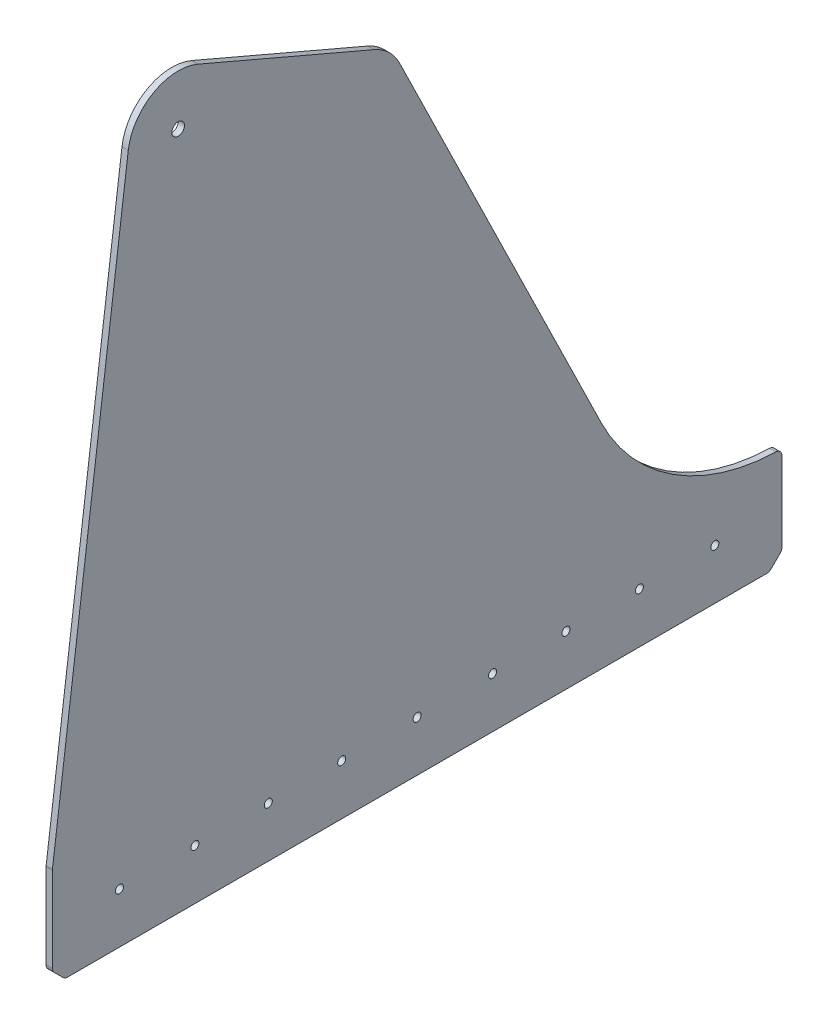
from build123d import *

# Parameters (mm, degrees)
PLATE_DEPTH                = 3.175
DRIVE_HOLES_D              = 4.064
SKETCH3_R                  = 3.175
TUBE_PIVOT_HOLES_DEPTH     = 521.864531932
BOTTOM_CORNER_CHAMFER_SIZE = 6.35
BOTTOM_CORNER_FILLET_R     = 3.175


with BuildPart() as part:
    # Sketch2 → Plate (new body)
    with BuildSketch(Plane(origin=(0, 0, 0), x_dir=(0, 0, -1), z_dir=(1, 0, 0))):
        with BuildLine():
            Line((0, 0), (0, 50.8))
            Line((0, 50.8), (38.311002826, 346.167173299))
            ThreePointArc((38.311002826, 346.167173299), (50.913223809, 364.962027675), (73.505550184, 366.246283762))
            Line((73.505550184, 366.246283762), (162.405550184, 328.146283762))
            ThreePointArc((162.405550184, 328.146283762), (169.906506384, 323.203321283), (175.217732235, 315.958453999))
            Line((175.217732235, 315.958453999), (277.02907106, 107.766184002))
            ThreePointArc((277.02907106, 107.766184002), (314.505184754, 66.210221878), (368.3, 50.8))
            Line((368.3, 50.8), (368.3, 0))
            Line((368.3, 0), (0, 0))
        make_face()
    extrude(amount=PLATE_DEPTH)

    # Drive Holes (through all)
    with Locations(Plane(origin=(3.175, 0, 0), x_dir=(0, 0, -1), z_dir=(1, 0, 0))):
        with Locations((184.15, 25.4), (222.25, 25.4), (259.291666667, 25.4), (296.333333333, 25.4), (334.433333333, 25.4), (146.05, 25.4), (109.008333333, 25.4), (71.966666667, 25.4), (33.866666667, 25.4)):
            Hole(DRIVE_HOLES_D / 2)

    # Sketch3 → Tube Pivot Holes (cut, through all)
    with BuildSketch(Plane(origin=(3.175, 0, 0), x_dir=(0, 0, -1), z_dir=(1, 0, 0))):
        with Locations((63.5, 342.9)):
            Circle(SKETCH3_R)
    extrude(amount=-TUBE_PIVOT_HOLES_DEPTH, mode=Mode.SUBTRACT)

    # Bottom Corner Chamfer
    bottom_corner_chamfer_edges = [part.edges().sort_by_distance(p)[0] for p in [
        (1.5875, 0, -368.3),
        (1.5875, 0, 0),
    ]]
    chamfer(bottom_corner_chamfer_edges, length=BOTTOM_CORNER_CHAMFER_SIZE)

    # Bottom Corner Fillet
    bottom_corner_fillet_edges = [part.edges().sort_by_distance(p)[0] for p in [
        (1.5875, 50.8, 0),
        (1.5875, 0, -6.35),
        (1.5875, 6.35, 0),
        (1.5875, 0, -361.95),
        (1.5875, 6.35, -368.3),
        (1.5875, 50.8, -368.3),
    ]]
    fillet(bottom_corner_fillet_edges, radius=BOTTOM_CORNER_FILLET_R)


solid = part.part
